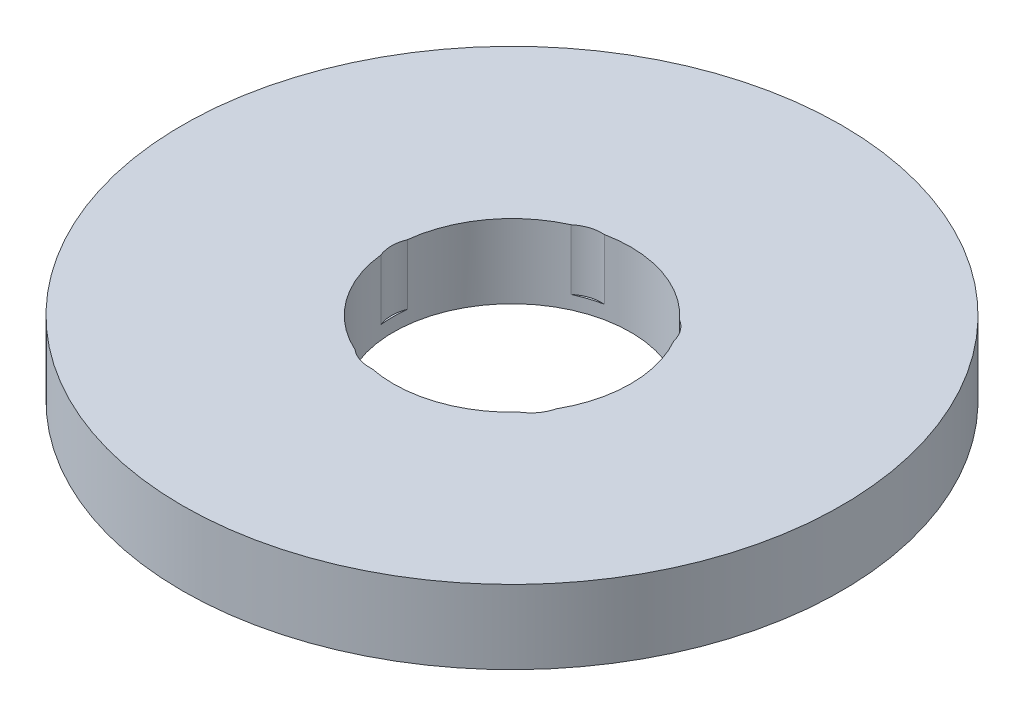
from build123d import *

# Parameters (mm, degrees)
SKETCH1_R           = 62.5
BOSS_EXTRUDE1_DEPTH = 14
SKETCH2_R           = 22.5
CUT_EXTRUDE1_DEPTH  = 90.49022293
SKETCH3_R           = 6.640188267
CUT_EXTRUDE2_DEPTH  = 11.447957574
CIRPATTERN1_COUNT   = 5


with BuildPart() as part:
    # Sketch1 → Boss-Extrude1 (new body)
    with BuildSketch(Plane(origin=(0, 0, 0), x_dir=(1, 0, 0), z_dir=(0, 1, 0))):
        Circle(SKETCH1_R)
    extrude(amount=BOSS_EXTRUDE1_DEPTH)

    # Sketch2 → Cut-Extrude1 (cut, through all)
    with BuildSketch(Plane(origin=(0, 0, 0), x_dir=(1, 0, 0), z_dir=(0, 1, 0))):
        Circle(SKETCH2_R)
    extrude(amount=CUT_EXTRUDE1_DEPTH, mode=Mode.SUBTRACT)

    # Sketch3 → Cut-Extrude2 (cut)
    with BuildSketch(Plane(origin=(0, 14, 0), x_dir=(1, 0, 0), z_dir=(0, 1, 0))):
        with Locations((-16.210166936, 0)):
            Circle(SKETCH3_R)
    cut_extrude2 = extrude(amount=-CUT_EXTRUDE2_DEPTH, mode=Mode.SUBTRACT)

    # CirPattern1: Cut-Extrude2 ×5 about axis
    cirpattern1_axis = Axis((0, 0, 0), (0, 1, 0))
    for i in range(1, CIRPATTERN1_COUNT):
        add(cut_extrude2.rotate(cirpattern1_axis, i * 360 / CIRPATTERN1_COUNT), mode=Mode.SUBTRACT)


solid = part.part
